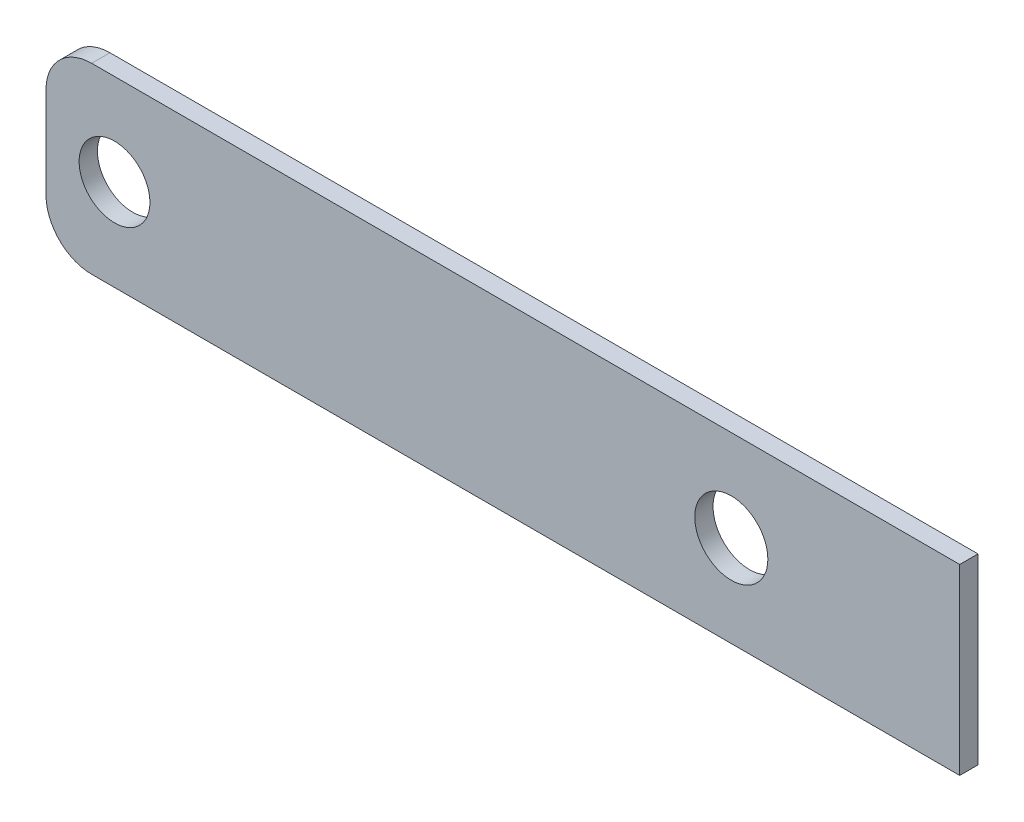
from build123d import *

# Parameters (mm, degrees)
IZIM1_W               = 200
IZIM1_H               = 40
TABAN_FLAN_1_DEPTH    = 4
IZIM6_R               = 7.75
IZIM6_R_2             = 8
KES_EKSTR_ZYON1_DEPTH = 10
RADYUS1_R             = 10


# Sheet-metal steps are written as plain solids
with BuildPart() as part:
    # Çizim1 → Taban-Flanş1 (new body)
    with BuildSketch(Plane.XY):
        Rectangle(IZIM1_W, IZIM1_H)
    extrude(amount=-TABAN_FLAN_1_DEPTH)

    # Çizim6 → Kes-Ekstrüzyon1 (cut)
    with BuildSketch(Plane.XY):
        with Locations((-85, 0)):
            Circle(IZIM6_R)
        with Locations((50, 0)):
            Circle(IZIM6_R_2)
    extrude(amount=-KES_EKSTR_ZYON1_DEPTH, mode=Mode.SUBTRACT)

    # Radyus1
    radyus1_edges = [part.edges().sort_by_distance(p)[0] for p in [
        (-100, -20, -2),
        (-100, 20, -2),
    ]]
    fillet(radyus1_edges, radius=RADYUS1_R)


solid = part.part
